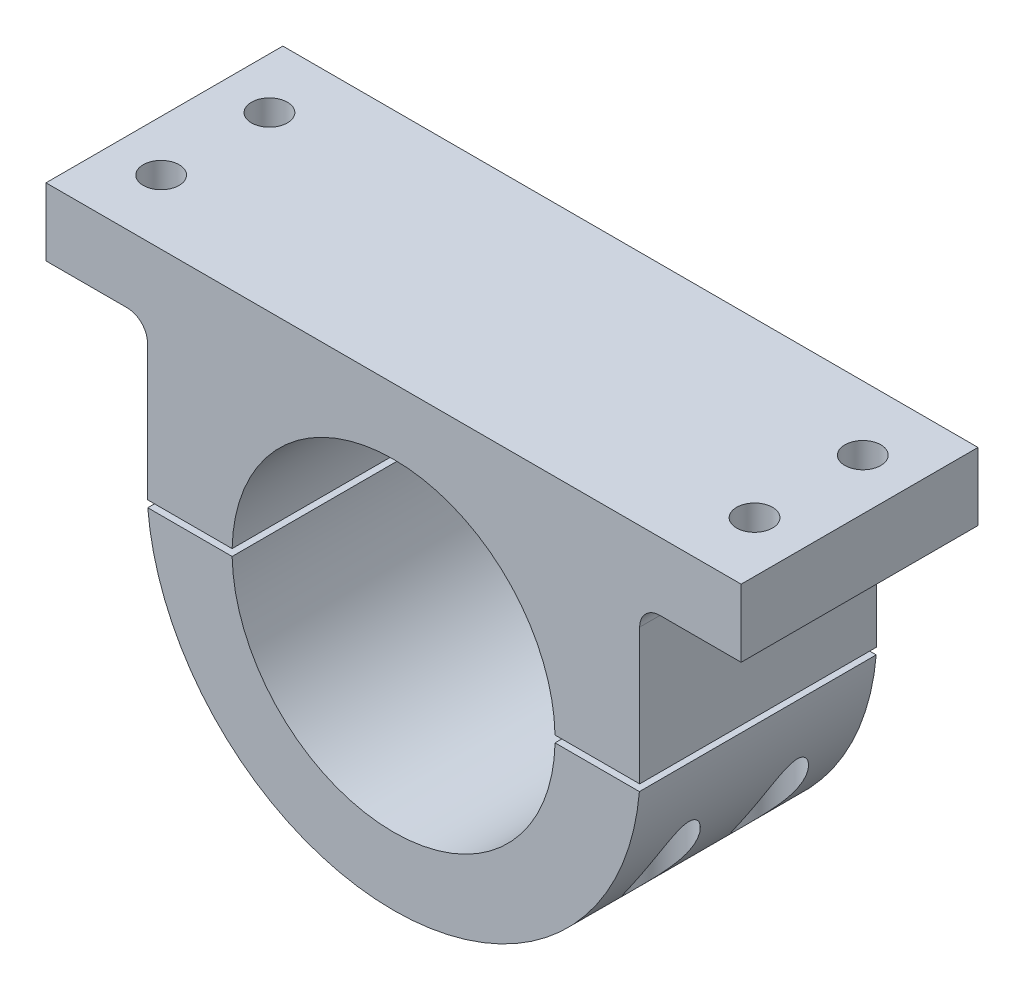
from build123d import *

# Parameters (mm, degrees)
SKETCH1_R                                     = 60.621
BOSS_EXTRUDE1_DEPTH                           = 88.9
CUT_EXTRUDE1_DEPTH                            = 155.386605902
CUT_EXTRUDE1_DEPTH_BACK                       = 155.386605902
SKETCH2_W                                     = 184.742
SKETCH2_H                                     = 2.54
ADVANCEDHOLE1_START                           = -58.252162376
ADVANCEDHOLE1_OUTLINE_R                       = 10.31875
ADVANCEDHOLE1_DEPTH                           = 35.731162376
ADVANCEDHOLE1_START_2                         = -22.521
ADVANCEDHOLE1_2_OUTLINE_R                     = 6.74624
ADVANCEDHOLE1_2_DEPTH                         = 21.251
SKETCH10_W                                    = 88.9
SKETCH10_H                                    = 25.4
BOSS_EXTRUDE2_DEPTH                           = 38.1
CBORE_FOR_1_2_SOCKET_HEAD_CAP_SCREW1_AT_COUNT = 2
CBORE_FOR_1_2_SOCKET_HEAD_CAP_SCREW1_AT_PITCH = 40.64
FILLET1_R                                     = 7.62


# Read off the part's stored shape, not the designer's step: AdvancedHole1
with BuildPart() as part:
    # Sketch1 → Boss-Extrude1 (new body)
    with BuildSketch(Plane.XY):
        with BuildLine():
            Line((92.371, 85.259), (-92.371, 85.259))
            Line((-92.371, 85.259), (-92.371, 0))
            ThreePointArc((-92.371, 0), (0, -86.021), (92.371, 0))
            Line((92.371, 0), (92.371, 85.259))
        make_face()
        Circle(SKETCH1_R, mode=Mode.SUBTRACT)
    extrude(amount=-BOSS_EXTRUDE1_DEPTH)

    # Sketch2 → Cut-Extrude1 (cut, two sides: drawn at the far end of the back side and taken through both)
    with BuildSketch(Plane.XY.offset(-CUT_EXTRUDE1_DEPTH_BACK)):
        Rectangle(SKETCH2_W, SKETCH2_H)
    extrude(amount=CUT_EXTRUDE1_DEPTH + CUT_EXTRUDE1_DEPTH_BACK, mode=Mode.SUBTRACT)


with BuildPart() as cut_extrude1_piece_1:
    # of the separate pieces the step leaves, piece 1, a body of its own (cut_extrude1_pieces)
    add(part.part.solids().sort_by_distance((92.371, 1.27, 0))[0])

    # AdvancedHole1 3 outline → AdvancedHole1 3 (revolve, cut)
    with BuildSketch(Plane(origin=(-76.439691751, 0, -64.77), x_dir=(1, 0, 0), z_dir=(0, 0, 1))):
        Polygon((5.35813, 1.27), (5.35813, 49.53), (0, 52.749489309), (0, 1.27), align=None)
    revolve(axis=Axis((-76.439691751, 0, -64.77), (0, 1, 0)), mode=Mode.SUBTRACT)

    # AdvancedHole1 4 outline → AdvancedHole1 4 (revolve, cut)
    with BuildSketch(Plane(origin=(-76.439691751, 0, -24.13), x_dir=(1, 0, 0), z_dir=(0, 0, 1))):
        Polygon((5.35813, 1.27), (5.35813, 49.53), (0, 52.749489309), (0, 1.27), align=None)
    revolve(axis=Axis((-76.439691751, 0, -24.13), (0, 1, 0)), mode=Mode.SUBTRACT)

    # AdvancedHole1 5 outline → AdvancedHole1 5 (revolve, cut)
    with BuildSketch(Plane(origin=(76.439691751, 0, -64.77), x_dir=(1, 0, 0), z_dir=(0, 0, 1))):
        Polygon((5.35813, 1.27), (5.35813, 49.53), (0, 52.749489309), (0, 1.27), align=None)
    revolve(axis=Axis((76.439691751, 0, -64.77), (0, 1, 0)), mode=Mode.SUBTRACT)

    # AdvancedHole1 6 outline → AdvancedHole1 6 (revolve, cut)
    with BuildSketch(Plane(origin=(76.439691751, 0, -24.13), x_dir=(1, 0, 0), z_dir=(0, 0, 1))):
        Polygon((5.35813, 1.27), (5.35813, 49.53), (0, 52.749489309), (0, 1.27), align=None)
    revolve(axis=Axis((76.439691751, 0, -24.13), (0, 1, 0)), mode=Mode.SUBTRACT)

    # Sketch10 → Boss-Extrude2 (add)
    with BuildSketch(Plane(origin=(92.371, 0, 0), x_dir=(0, 0, -1), z_dir=(1, 0, 0))):
        with Locations((44.45, 72.559)):
            Rectangle(SKETCH10_W, SKETCH10_H)
    boss_extrude2 = extrude(amount=BOSS_EXTRUDE2_DEPTH)

    # Sketch12 → CBORE for 1/2 Socket Head Cap Screw1 (revolve, cut)
    with BuildSketch(Plane(origin=(111.371344054, 59.859, -64.77), x_dir=(0, 0, -1), z_dir=(1, 0, 0))):
        Polygon((0, 0), (0, 25.401), (6.74624, 25.401), (6.74624, 12.7), (10.31875, 12.7), (10.31875, 0.635), (10.95375, 0), align=None)
    cbore_for_1_2_socket_head_cap_screw1 = revolve(axis=Axis((111.371344054, 53.509, -64.77), (0, 1, 0)), mode=Mode.SUBTRACT)

    # CBORE for 1/2 Socket Head Cap Screw1 at: CBORE for 1/2 Socket Head Cap Screw1 ×2
    with Locations(*[(0, 0, i * CBORE_FOR_1_2_SOCKET_HEAD_CAP_SCREW1_AT_PITCH) for i in range(1, CBORE_FOR_1_2_SOCKET_HEAD_CAP_SCREW1_AT_COUNT)]):
        add(cbore_for_1_2_socket_head_cap_screw1, mode=Mode.SUBTRACT)

    # Mirror1: Boss-Extrude2, CBORE for 1/2 Socket Head Cap Screw1 across plane
    add(boss_extrude2.mirror(Plane(origin=(0, 0, 0), x_dir=(0, 0, 1), z_dir=(1, 0, 0))))
    add(cbore_for_1_2_socket_head_cap_screw1.mirror(Plane(origin=(0, 0, 0), x_dir=(0, 0, 1), z_dir=(1, 0, 0))), mode=Mode.SUBTRACT)

    # Mirror1 copy 1 sketch → Mirror1 copy 1 (revolve, cut)
    with BuildSketch(Plane(origin=(-111.371344054, 59.859, -24.13), x_dir=(0, 0, -1), z_dir=(-1, 0, 0))):
        Polygon((0, 0), (0, -25.401), (6.74624, -25.401), (6.74624, -12.7), (10.31875, -12.7), (10.31875, -0.635), (10.95375, 0), align=None)
    revolve(axis=Axis((-111.371344054, 53.509, -24.13), (0, -1, 0)), mode=Mode.SUBTRACT)

    # Fillet1
    fillet1_edges = [cut_extrude1_piece_1.edges().sort_by_distance(p)[0] for p in [
        (92.371, 59.859, -44.45),
        (-92.371, 59.859, -44.45),
    ]]
    fillet(fillet1_edges, radius=FILLET1_R)


with BuildPart() as cut_extrude1_piece_2:
    # of the separate pieces the step leaves, piece 2, a body of its own (cut_extrude1_pieces)
    add(part.part.solids().sort_by_distance((-92.271688107, -1.27, 0))[0])

    # AdvancedHole1 outline → AdvancedHole1 (cut)
    with BuildSketch(Plane(origin=(0, 0, 0), x_dir=(1, 0, 0), z_dir=(0, 1, 0)).offset(ADVANCEDHOLE1_START)):
        with Locations((-76.439691751, 64.77)):
            Circle(ADVANCEDHOLE1_OUTLINE_R)
        with Locations((-76.439691751, 24.13)):
            Circle(ADVANCEDHOLE1_OUTLINE_R)
        with Locations((76.439691751, 64.77)):
            Circle(ADVANCEDHOLE1_OUTLINE_R)
        with Locations((76.439691751, 24.13)):
            Circle(ADVANCEDHOLE1_OUTLINE_R)
    extrude(amount=ADVANCEDHOLE1_DEPTH, mode=Mode.SUBTRACT)

    # AdvancedHole1 2 outline → AdvancedHole1 2 (cut)
    with BuildSketch(Plane(origin=(0, 0, 0), x_dir=(1, 0, 0), z_dir=(0, 1, 0)).offset(ADVANCEDHOLE1_START_2)):
        with Locations((-76.439691751, 64.77)):
            Circle(ADVANCEDHOLE1_2_OUTLINE_R)
        with Locations((-76.439691751, 24.13)):
            Circle(ADVANCEDHOLE1_2_OUTLINE_R)
        with Locations((76.439691751, 64.77)):
            Circle(ADVANCEDHOLE1_2_OUTLINE_R)
        with Locations((76.439691751, 24.13)):
            Circle(ADVANCEDHOLE1_2_OUTLINE_R)
    extrude(amount=ADVANCEDHOLE1_2_DEPTH, mode=Mode.SUBTRACT)


solid = Compound([cut_extrude1_piece_1.part, cut_extrude1_piece_2.part])
